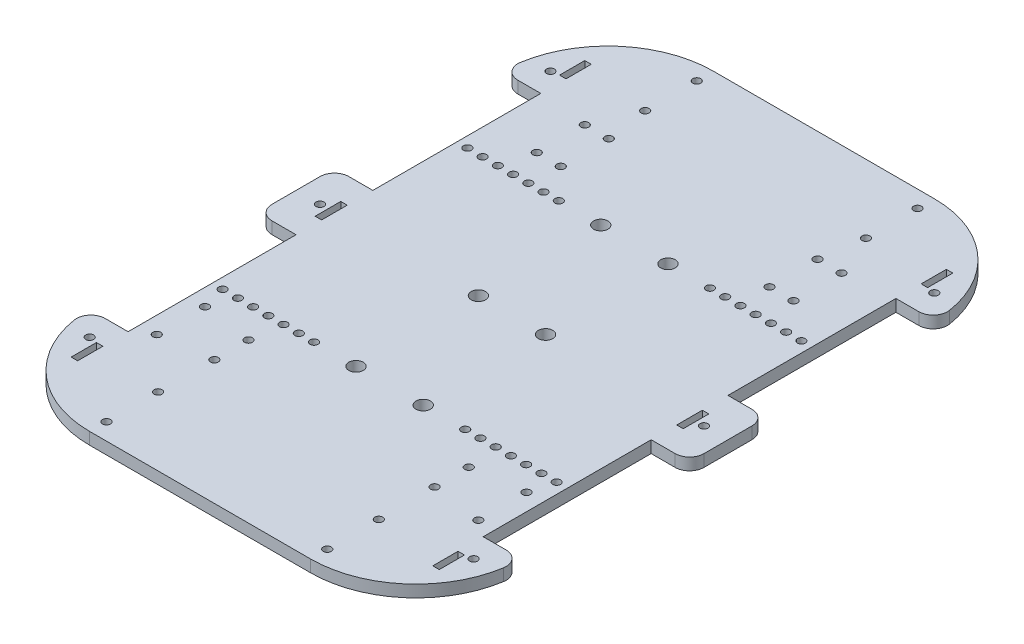
from build123d import *

# Parameters (mm, degrees)
SKETCH2_W           = 2.7
SKETCH2_H           = 10.51
SKETCH2_H_2         = 10.666666666
BOSS_EXTRUDE4_DEPTH = 5
SKETCH5_R           = 1.65
SKETCH5_R_2         = 3
CUT_EXTRUDE1_DEPTH  = 159.192920196


with BuildPart() as part:
    # Sketch2 → Boss-Extrude4 (new body)
    with BuildSketch(Plane(origin=(0, 0, 0), x_dir=(1, 0, 0), z_dir=(0, 1, 0))):
        with BuildLine():
            Line((46, -130), (-46, -130))
            ThreePointArc((-46, -130), (-74.550970119, -119.478980051), (-89.448061775, -92.947368421))
            ThreePointArc((-89.448061775, -92.947368421), (-88.08864154, -88.106685893), (-83.523326079, -86))
            Line((-83.523326079, -86), (-74, -86))
            Line((-74, -86), (-74, -16))
            Line((-74, -16), (-84, -16))
            ThreePointArc((-84, -16), (-88.242640687, -14.242640687), (-90, -10))
            Line((-90, -10), (-90, 10))
            ThreePointArc((-90, 10), (-88.242640687, 14.242640687), (-84, 16))
            Line((-84, 16), (-74, 16))
            Line((-74, 16), (-74, 86))
            Line((-74, 86), (-83.523326079, 86))
            ThreePointArc((-83.523326079, 86), (-88.08864154, 88.106685893), (-89.448061775, 92.947368421))
            ThreePointArc((-89.448061775, 92.947368421), (-74.550970119, 119.478980051), (-46, 130))
            Line((-46, 130), (46, 130))
            ThreePointArc((46, 130), (74.550970119, 119.478980051), (89.448061775, 92.947368421))
            ThreePointArc((89.448061775, 92.947368421), (88.08864154, 88.106685893), (83.523326079, 86))
            Line((83.523326079, 86), (74, 86))
            Line((74, 86), (74, 16))
            Line((74, 16), (84, 16))
            ThreePointArc((84, 16), (88.242640687, 14.242640687), (90, 10))
            Line((90, 10), (90, -10))
            ThreePointArc((90, -10), (88.242640687, -14.242640687), (84, -16))
            Line((84, -16), (74, -16))
            Line((74, -16), (74, -86))
            Line((74, -86), (83.523326079, -86))
            ThreePointArc((83.523326079, -86), (88.08864154, -88.106685893), (89.448061775, -92.947368421))
            ThreePointArc((89.448061775, -92.947368421), (74.550970119, -119.478980051), (46, -130))
        make_face()
        with Locations((-75.35, 101.765)):
            Rectangle(SKETCH2_W, SKETCH2_H, mode=Mode.SUBTRACT)
        with Locations((75.35, 101.765)):
            Rectangle(SKETCH2_W, SKETCH2_H, mode=Mode.SUBTRACT)
        with Locations((75.35, -101.765)):
            Rectangle(SKETCH2_W, SKETCH2_H, mode=Mode.SUBTRACT)
        with Locations((-75.35, -101.765)):
            Rectangle(SKETCH2_W, SKETCH2_H, mode=Mode.SUBTRACT)
        with Locations((-75.35, 0)):
            Rectangle(SKETCH2_W, SKETCH2_H_2, mode=Mode.SUBTRACT)
        with Locations((75.35, 0)):
            Rectangle(SKETCH2_W, SKETCH2_H_2, mode=Mode.SUBTRACT)
    extrude(amount=BOSS_EXTRUDE4_DEPTH)

    # Sketch5 → Cut-Extrude1 (cut, through all)
    with BuildSketch(Plane(origin=(0, 5, 0), x_dir=(1, 0, 0), z_dir=(0, 1, 0))):
        with Locations((-69.6, -51)):
            Circle(SKETCH5_R)
        with Locations((-63.25, -51)):
            Circle(SKETCH5_R)
        with Locations((-56.9, -51)):
            Circle(SKETCH5_R)
        with Locations((-50.55, -51)):
            Circle(SKETCH5_R)
        with Locations((-44.2, -51)):
            Circle(SKETCH5_R)
        with Locations((-37.85, -51)):
            Circle(SKETCH5_R)
        with Locations((-31.5, -51)):
            Circle(SKETCH5_R)
        with Locations((31.5, -51)):
            Circle(SKETCH5_R)
        with Locations((37.85, -51)):
            Circle(SKETCH5_R)
        with Locations((44.2, -51)):
            Circle(SKETCH5_R)
        with Locations((50.55, -51)):
            Circle(SKETCH5_R)
        with Locations((56.9, -51)):
            Circle(SKETCH5_R)
        with Locations((63.25, -51)):
            Circle(SKETCH5_R)
        with Locations((69.6, -51)):
            Circle(SKETCH5_R)
        with Locations((69.6, 51)):
            Circle(SKETCH5_R)
        with Locations((63.25, 51)):
            Circle(SKETCH5_R)
        with Locations((56.9, 51)):
            Circle(SKETCH5_R)
        with Locations((50.55, 51)):
            Circle(SKETCH5_R)
        with Locations((44.2, 51)):
            Circle(SKETCH5_R)
        with Locations((37.85, 51)):
            Circle(SKETCH5_R)
        with Locations((31.5, 51)):
            Circle(SKETCH5_R)
        with Locations((-31.5, 51)):
            Circle(SKETCH5_R)
        with Locations((-37.85, 51)):
            Circle(SKETCH5_R)
        with Locations((-44.2, 51)):
            Circle(SKETCH5_R)
        with Locations((-50.55, 51)):
            Circle(SKETCH5_R)
        with Locations((-56.9, 51)):
            Circle(SKETCH5_R)
        with Locations((-63.25, 51)):
            Circle(SKETCH5_R)
        with Locations((-69.6, 51)):
            Circle(SKETCH5_R)
        with Locations((-14, -51)):
            Circle(SKETCH5_R_2)
        with Locations((14, -51)):
            Circle(SKETCH5_R_2)
        with Locations((14, 51)):
            Circle(SKETCH5_R_2)
        with Locations((-14, 51)):
            Circle(SKETCH5_R_2)
        with Locations((-14, 0)):
            Circle(SKETCH5_R_2)
        with Locations((14, 0)):
            Circle(SKETCH5_R_2)
        with Locations((-80, 96)):
            Circle(SKETCH5_R)
        with Locations((-80, 0)):
            Circle(SKETCH5_R)
        with Locations((80, 0)):
            Circle(SKETCH5_R)
        with Locations((-80, -96)):
            Circle(SKETCH5_R)
        with Locations((80, -96)):
            Circle(SKETCH5_R)
        with Locations((80, 96)):
            Circle(SKETCH5_R)
        with Locations((-53.5, 83.83)):
            Circle(SKETCH5_R)
        with Locations((-53.5, 63.83)):
            Circle(SKETCH5_R)
        with Locations((-43.5, 63.83)):
            Circle(SKETCH5_R)
        with Locations((-43.5, 83.83)):
            Circle(SKETCH5_R)
        with Locations((43.5, 63.83)):
            Circle(SKETCH5_R)
        with Locations((53.5, 63.83)):
            Circle(SKETCH5_R)
        with Locations((43.5, 83.83)):
            Circle(SKETCH5_R)
        with Locations((53.5, 83.83)):
            Circle(SKETCH5_R)
        with Locations((-46, 123)):
            Circle(SKETCH5_R)
        with Locations((-46, 101.5)):
            Circle(SKETCH5_R)
        with Locations((46, 101.5)):
            Circle(SKETCH5_R)
        with Locations((46, 123)):
            Circle(SKETCH5_R)
        with Locations((-67, -60.960027583)):
            Circle(SKETCH5_R)
        with Locations((-45.897115189, -63.923125828)):
            Circle(SKETCH5_R)
        with Locations((-67, -81.039972417)):
            Circle(SKETCH5_R)
        with Locations((-45.897115189, -78.156819007)):
            Circle(SKETCH5_R)
        with Locations((45.897115189, -63.923125828)):
            Circle(SKETCH5_R)
        with Locations((45.897115189, -78.156819007)):
            Circle(SKETCH5_R)
        with Locations((67, -81.039972417)):
            Circle(SKETCH5_R)
        with Locations((67, -60.960027583)):
            Circle(SKETCH5_R)
        with Locations((46, -123)):
            Circle(SKETCH5_R)
        with Locations((46, -101.5)):
            Circle(SKETCH5_R)
        with Locations((-46, -101.5)):
            Circle(SKETCH5_R)
        with Locations((-46, -123)):
            Circle(SKETCH5_R)
    extrude(amount=-CUT_EXTRUDE1_DEPTH, mode=Mode.SUBTRACT)


solid = part.part
